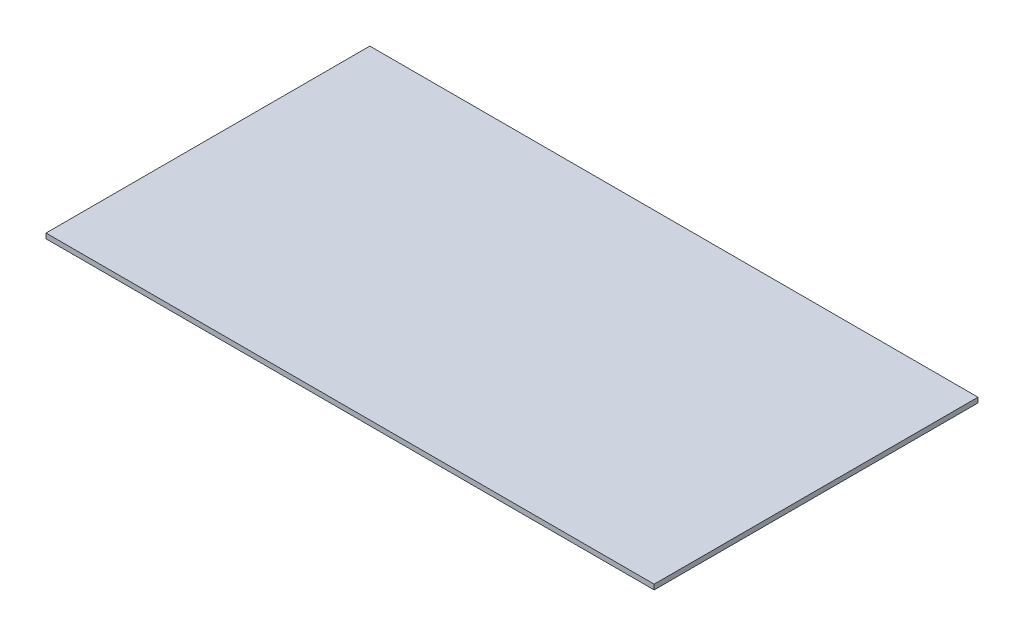
from build123d import *

# Parameters (mm, degrees)
SKETCH1_W           = 1540
SKETCH1_H           = 820
BOSS_EXTRUDE1_DEPTH = 12.7


with BuildPart() as part:
    # Sketch1 → Boss-Extrude1 (new body)
    with BuildSketch(Plane(origin=(0, 0, 0), x_dir=(1, 0, 0), z_dir=(0, 1, 0))):
        Rectangle(SKETCH1_W, SKETCH1_H)
    extrude(amount=BOSS_EXTRUDE1_DEPTH)


solid = part.part
